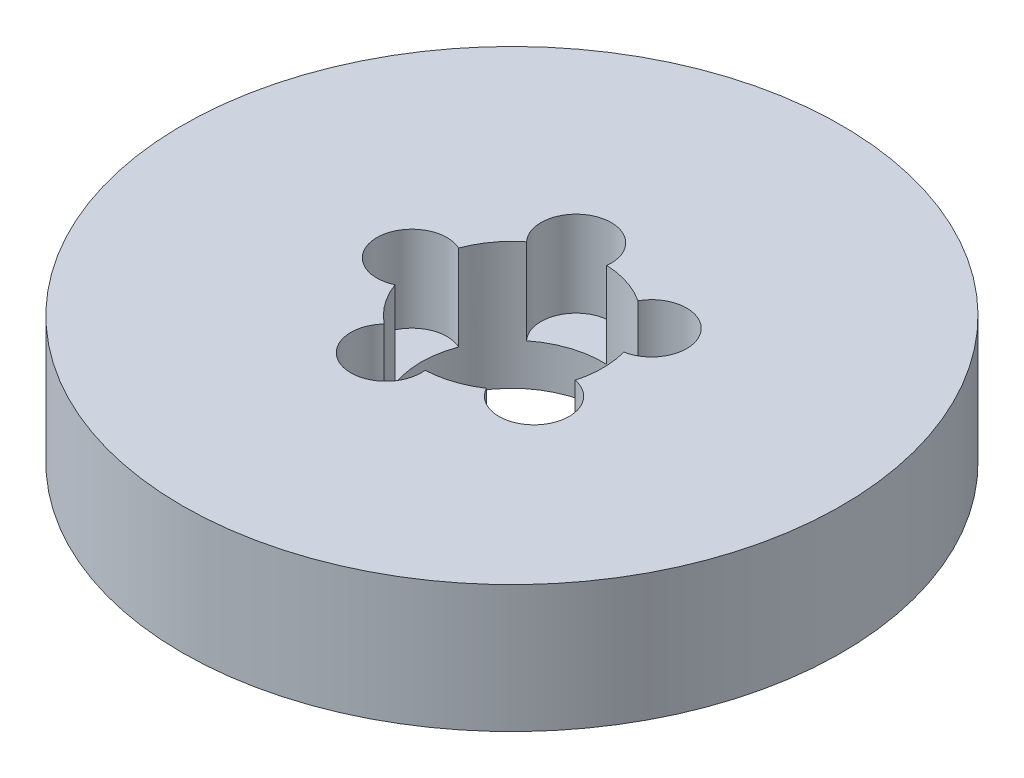
from build123d import *

# Parameters (mm, degrees)
SKETCH1_R           = 72.5
BOSS_EXTRUDE1_DEPTH = 28
SKETCH2_R           = 20
CUT_EXTRUDE1_DEPTH  = 107.284994237
SKETCH3_R           = 7.724827951
CUT_EXTRUDE2_DEPTH  = 18.86016759
CIRPATTERN1_COUNT   = 5


with BuildPart() as part:
    # Sketch1 → Boss-Extrude1 (new body)
    with BuildSketch(Plane(origin=(0, 0, 0), x_dir=(1, 0, 0), z_dir=(0, 1, 0))):
        Circle(SKETCH1_R)
    extrude(amount=BOSS_EXTRUDE1_DEPTH)

    # Sketch2 → Cut-Extrude1 (cut, through all)
    with BuildSketch(Plane(origin=(0, 0, 0), x_dir=(1, 0, 0), z_dir=(0, 1, 0))):
        Circle(SKETCH2_R)
    extrude(amount=CUT_EXTRUDE1_DEPTH, mode=Mode.SUBTRACT)

    # Sketch3 → Cut-Extrude2 (cut)
    with BuildSketch(Plane(origin=(0, 28, 0), x_dir=(1, 0, 0), z_dir=(0, 1, 0))):
        with Locations((-21.998412588, 0)):
            Circle(SKETCH3_R)
    cut_extrude2 = extrude(amount=-CUT_EXTRUDE2_DEPTH, mode=Mode.SUBTRACT)

    # CirPattern1: Cut-Extrude2 ×5 about axis
    cirpattern1_axis = Axis((0, 0, 0), (0, 1, 0))
    for i in range(1, CIRPATTERN1_COUNT):
        add(cut_extrude2.rotate(cirpattern1_axis, i * 360 / CIRPATTERN1_COUNT), mode=Mode.SUBTRACT)


solid = part.part
